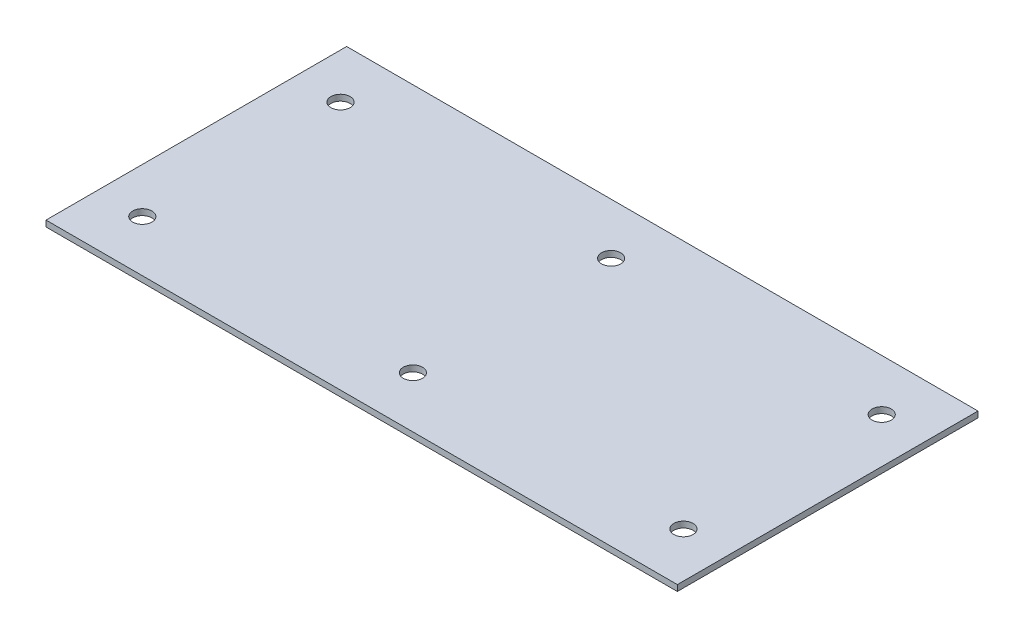
from build123d import *

# Parameters (mm, degrees)
SKETCH_1_W      = 210
SKETCH_1_H      = 100
SKETCH_1_R      = 3.2
EXTRUDE_1_DEPTH = 2


with BuildPart() as part:
    # Эскиз1 → Бобышка-Вытянуть1 (new body)
    with BuildSketch(Plane(origin=(0, 0, 0), x_dir=(1, 0, 0), z_dir=(0, 1, 0))):
        with Locations((105, 50)):
            Rectangle(SKETCH_1_W, SKETCH_1_H)
        with Locations((195, 17.034247801)):
            Circle(SKETCH_1_R, mode=Mode.SUBTRACT)
        with Locations((105, 17.034247801)):
            Circle(SKETCH_1_R, mode=Mode.SUBTRACT)
        with Locations((15, 17.034247801)):
            Circle(SKETCH_1_R, mode=Mode.SUBTRACT)
        with Locations((195, 82.965752199)):
            Circle(SKETCH_1_R, mode=Mode.SUBTRACT)
        with Locations((105, 82.965752199)):
            Circle(SKETCH_1_R, mode=Mode.SUBTRACT)
        with Locations((15, 82.965752199)):
            Circle(SKETCH_1_R, mode=Mode.SUBTRACT)
    extrude(amount=EXTRUDE_1_DEPTH)


solid = part.part
